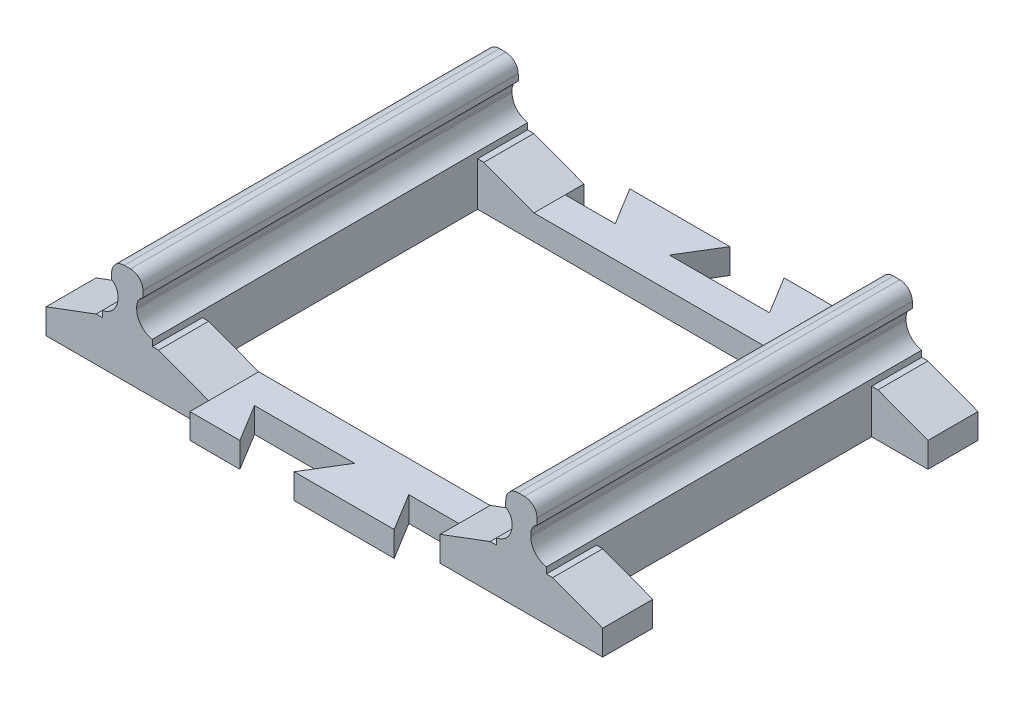
from build123d import *

# Parameters (mm, degrees)
SKETCH_1_W               = 4
SKETCH_1_H               = 11
SKETCH_1_H_2             = 8
EXTRUDE_1_DEPTH          = 4
SKETCH_1_7_W             = 44.5
SKETCH_1_7_H             = 8
EXTRUDE_2_DEPTH          = 3.5
SKETCH_2_W               = 18.5
SKETCH_2_H               = 1.5
CUT_EXTRUDE_1_DEPTH      = 30.53070436
SKETCH_2_3_W             = 2.5
SKETCH_2_3_H             = 1.5
EXTRUDE_4_DEPTH          = 19
FILLET_1_R               = 1
FILLET_2_R               = 1.5
FILLET_3_R               = 1
CUT_EXTRUDE_2_DEPTH      = 37.65122781
CUT_EXTRUDE_2_DEPTH_BACK = 37.65122781


with BuildPart() as part:
    # 草图1 → 凸台-拉伸1 (new body)
    with BuildSketch(Plane(origin=(0, 0, 0), x_dir=(1, 0, 0), z_dir=(0, 1, 0))):
        with Locations((-15.75, -4)):
            Rectangle(SKETCH_1_W, SKETCH_1_H)
        with Locations((15.75, -4)):
            Rectangle(SKETCH_1_W, SKETCH_1_H)
        with Locations((15.75, 5.5)):
            Rectangle(SKETCH_1_W, SKETCH_1_H_2)
        with Locations((-15.75, 5.5)):
            Rectangle(SKETCH_1_W, SKETCH_1_H_2)
    extrude(amount=EXTRUDE_1_DEPTH)

    # 草图1<7> → 凸台-拉伸2 (add)
    with BuildSketch(Plane(origin=(0, 0, 0), x_dir=(1, 0, 0), z_dir=(0, 1, 0))):
        with Locations((0, 5.5)):
            Rectangle(SKETCH_1_7_W, SKETCH_1_7_H)
    extrude(amount=EXTRUDE_2_DEPTH)

    # 草图2 → 切除-拉伸1 (cut, through all)
    with BuildSketch(Plane(origin=(0, 0, -9.5), x_dir=(-1, 0, 0), z_dir=(0, 0, -1))):
        with Locations((0, 2.75)):
            Rectangle(SKETCH_2_W, SKETCH_2_H)
        Polygon((13.25, 3.5), (9.25, 3.5), (9.25, 2), align=None)
        Polygon((-9.25, 3.5), (-13.25, 3.5), (-9.25, 2), align=None)
        Polygon((-22.25, 3.5), (-22.25, 2), (-18.25, 3.5), align=None)
        Polygon((22.25, 3.5), (18.25, 3.5), (22.25, 2), align=None)
    extrude(amount=-CUT_EXTRUDE_1_DEPTH, mode=Mode.SUBTRACT)

    # 草图2<3> → 凸台-拉伸4 (add, through all)
    with BuildSketch(Plane(origin=(0, 0, -9.5), x_dir=(-1, 0, 0), z_dir=(0, 0, -1))):
        with Locations((-15.75, 7.25)):
            Rectangle(SKETCH_2_3_W, SKETCH_2_3_H)
        Polygon((-15, 6.5), (-16.5, 6.5), (-16.5, 4), (-15.75, 4), (-15, 4), align=None)
        with Locations((15.75, 7.25)):
            Rectangle(SKETCH_2_3_W, SKETCH_2_3_H)
        Polygon((16.5, 6.5), (15, 6.5), (15, 4), (15.75, 4), (16.5, 4), align=None)
    extrude(amount=-EXTRUDE_4_DEPTH)

    # 圆角1
    # the kernel refuses this fillet: 1 mm, written as the material it adds along each edge
    with BuildSketch(Plane(origin=(-16.5, 6.5, -9.5), x_dir=(0, -1, 0), z_dir=(0, 0, 1))) as fillet_1_piece_1:
        with BuildLine():
            CenterArc((0.866025404, -1), FILLET_1_R, 90, 60)
            Line((0, -0.5), (-0.017320508, -0.49))
            ThreePointArc((-0.017320508, -0.49), (-0.02, -0.25), (-0.02, 0))
            Line((-0.02, 0), (0, 0.02))
            Line((0, 0.02), (0.866025404, 0.02))
            Line((0.866025404, 0.02), (0.866025404, 0))
        make_face()
    extrude(amount=19)
    with BuildSketch(Plane(origin=(-15, 6.5, -9.5), x_dir=(0, -1, 0), z_dir=(0, 0, 1)), Plane(origin=(16.5, 6.5, -9.5), x_dir=(0, -1, 0), z_dir=(0, 0, 1))) as fillet_1_piece_2:
        with BuildLine():
            CenterArc((0.866025404, 1), FILLET_1_R, 210, 60)
            Line((0, 0.5), (-0.017320508, 0.49))
            ThreePointArc((-0.017320508, 0.49), (-0.02, 0.25), (-0.02, 0))
            Line((-0.02, 0), (0, -0.02))
            Line((0, -0.02), (0.866025404, -0.02))
            Line((0.866025404, -0.02), (0.866025404, 0))
        make_face()
    extrude(amount=19)
    with BuildSketch(Plane(origin=(15, 6.5, -9.5), x_dir=(-1, 0, 0), z_dir=(0, 0, 1))) as fillet_1_piece_3:
        with BuildLine():
            CenterArc((1, 0.866025404), FILLET_1_R, 180, 60)
            Line((0, 0.866025404), (-0.02, 0.866025404))
            Line((-0.02, 0.866025404), (-0.02, 0))
            Line((-0.02, 0), (0, -0.02))
            ThreePointArc((0, -0.02), (0.25, -0.02), (0.49, -0.017320508))
            Line((0.49, -0.017320508), (0.5, 0))
        make_face()
    extrude(amount=19)

    # 圆角2
    # the kernel refuses this fillet: 1.5 mm, written as the material it adds along each edge
    with BuildSketch(Plane(origin=(16.5, 4, -9.5), x_dir=(1, 0, 0), z_dir=(0, 0, 1)), Plane(origin=(-15, 4, -9.5), x_dir=(1, 0, 0), z_dir=(0, 0, 1))) as fillet_2_piece_1:
        with BuildLine():
            CenterArc((1.5, 1.479019946), FILLET_2_R, 180, 80.405931773)
            Line((0, 1.479019946), (-0.03, 1.479019946))
            Line((-0.03, 1.479019946), (-0.03, 0))
            Line((-0.03, 0), (0, -0.03))
            ThreePointArc((0, -0.03), (0.625, -0.03), (1.245, -0.029580399))
            Line((1.245, -0.029580399), (1.25, 0))
        make_face()
    extrude(amount=19)
    with BuildSketch(Plane(origin=(15, 4, -9.5), x_dir=(0, 1, 0), z_dir=(0, 0, 1)), Plane(origin=(-16.5, 4, -9.5), x_dir=(0, 1, 0), z_dir=(0, 0, 1))) as fillet_2_piece_2:
        with BuildLine():
            CenterArc((1.479019946, 1.5), FILLET_2_R, 189.594068227, 80.405931773)
            Line((0, 1.25), (-0.029580399, 1.245))
            ThreePointArc((-0.029580399, 1.245), (-0.03, 0.625), (-0.03, 0))
            Line((-0.03, 0), (0, -0.03))
            Line((0, -0.03), (1.479019946, -0.03))
            Line((1.479019946, -0.03), (1.479019946, 0))
        make_face()
    extrude(amount=19)

    # 圆角3
    fillet_3_edges = [part.edges().sort_by_distance(p)[0] for p in [
        (14.5, 8, 0),
        (17, 8, 0),
        (-17, 8, 0),
        (-14.5, 8, 0),
    ]]
    fillet(fillet_3_edges, radius=FILLET_3_R)

    # 镜向2: part across plane


with BuildPart() as part_1:
    add(part.part)
    add(part.part.mirror(Plane(origin=(0, 4, 9.5), x_dir=(1, 0, 0), z_dir=(0, 0, -1))))

    # 草图9 → 切除-拉伸2 (cut, two sides: drawn at the far end of the back side and taken through both)
    with BuildSketch(Plane(origin=(0, 2, 0), x_dir=(1, 0, 0), z_dir=(0, 1, 0)).offset(-CUT_EXTRUDE_2_DEPTH_BACK)):
        Polygon((-22.25, 5.5), (-9.25, 5.5), (-9.25, 4), (-5.25, 4), (-7.083333333, 7), (0.916666667, 7), (-0.916666667, 4), (7.083333333, 4), (5.25, 7), (9.25, 7), (9.25, 5.5), (22.25, 5.5), (22.25, 9.5), (-22.25, 9.5), align=None)
        Polygon((-22.25, -24.5), (-9.25, -24.5), (-9.25, -26), (-5.25, -26), (-7.083333333, -23), (0.916666667, -23), (-0.916666667, -26), (7.083333333, -26), (5.25, -23), (9.25, -23), (9.25, -24.5), (22.25, -24.5), (22.25, -28.5), (-22.25, -28.5), align=None)
    extrude(amount=CUT_EXTRUDE_2_DEPTH + CUT_EXTRUDE_2_DEPTH_BACK, mode=Mode.SUBTRACT)


solid = part_1.part
